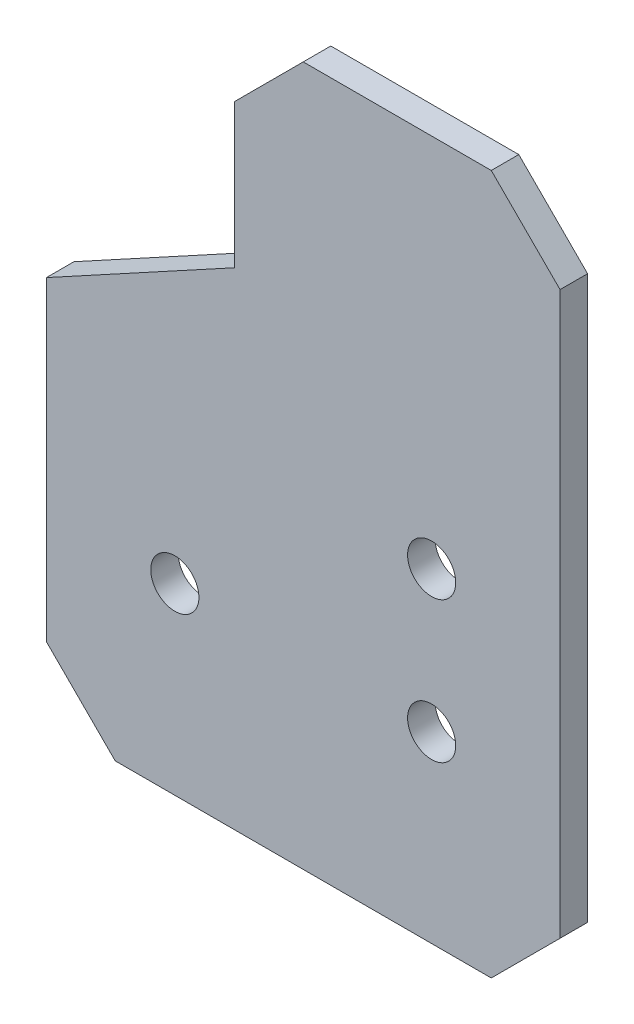
from build123d import *

# Parameters (mm, degrees)
SKETCH_1_R             = 5.25
SM_BASE_FLANGE_1_DEPTH = 6


# Sheet-metal steps are written as plain solids
with BuildPart() as part:
    # Sketch 1 → Базовая кромка1 (new body)
    with BuildSketch(Plane.XY):
        Polygon((-41, -102.5), (-56, -87.5), (-56, -18.731551379), (-15, 3.62230522), (-15, 35), (0, 50), (41, 50), (56, 35), (56, -87.5), (41, -102.5), align=None)
        with Locations((-28, -62.5)):
            Circle(SKETCH_1_R, mode=Mode.SUBTRACT)
        with Locations((28, -62.5)):
            Circle(SKETCH_1_R, mode=Mode.SUBTRACT)
        with Locations((28, -31.72618932)):
            Circle(SKETCH_1_R, mode=Mode.SUBTRACT)
    extrude(amount=-SM_BASE_FLANGE_1_DEPTH)


solid = part.part
